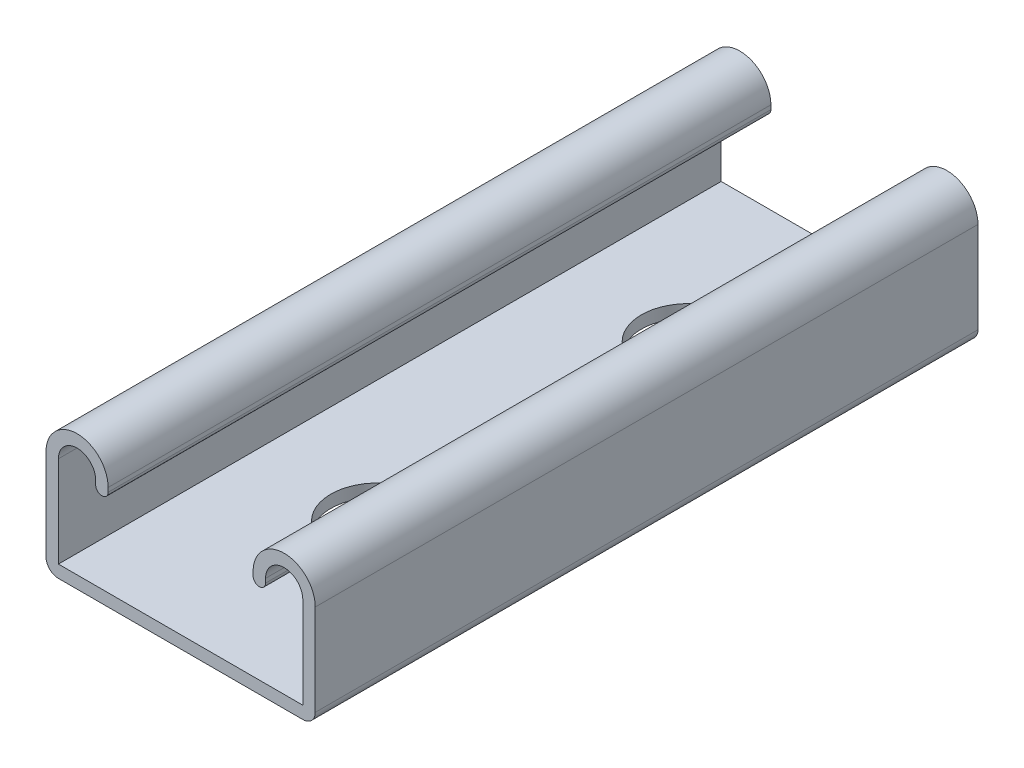
from build123d import *

# Parameters (mm, degrees)
BASE_EXTRUDE_DEPTH = 101.6
HOLE1_START        = -8.4582
HOLE1_OUTLINE_R    = 7.14375
HOLE1_DEPTH        = 1.905
LPATTERN2_COUNT    = 2
LPATTERN2_PITCH    = 47.625


with BuildPart() as part:
    # Sketch1 → Base-Extrude (new body)
    with BuildSketch(Plane.XY):
        with BuildLine():
            Line((-20.6375, 7.4295), (-20.6375, -6.5532))
            ThreePointArc((-20.6375, -6.5532), (-20.079538418, -7.900238418), (-18.7325, -8.4582))
            Line((-18.7325, -8.4582), (18.7325, -8.4582))
            ThreePointArc((18.7325, -8.4582), (20.079538418, -7.900238418), (20.6375, -6.5532))
            Line((20.6375, -6.5532), (20.6375, 7.4295))
            ThreePointArc((20.6375, 7.4295), (15.875, 12.192), (11.1125, 7.4295))
            Line((11.1125, 7.4295), (11.1125, 6.7945))
            ThreePointArc((11.1125, 6.7945), (12.065, 5.842), (13.0175, 6.7945))
            Line((13.0175, 6.7945), (13.0175, 7.4295))
            ThreePointArc((13.0175, 7.4295), (15.875, 10.287), (18.7325, 7.4295))
            Line((18.7325, 7.4295), (18.7325, -6.5532))
            Line((18.7325, -6.5532), (-18.7325, -6.5532))
            Line((-18.7325, -6.5532), (-18.7325, 7.4295))
            ThreePointArc((-18.7325, 7.4295), (-15.875, 10.287), (-13.0175, 7.4295))
            Line((-13.0175, 7.4295), (-13.0175, 6.7945))
            ThreePointArc((-13.0175, 6.7945), (-12.065, 5.842), (-11.1125, 6.7945))
            Line((-11.1125, 6.7945), (-11.1125, 7.4295))
            ThreePointArc((-11.1125, 7.4295), (-15.875, 12.192), (-20.6375, 7.4295))
        make_face()
    extrude(amount=BASE_EXTRUDE_DEPTH)

    # Hole1: read off the stored shape, not the designer's step
    # Hole1 outline → Hole1 (cut)
    with BuildSketch(Plane(origin=(0, 0, 0), x_dir=(1, 0, 0), z_dir=(0, 1, 0)).offset(HOLE1_START)):
        with Locations((0, -23.8125)):
            Circle(HOLE1_OUTLINE_R)
    hole1 = extrude(amount=HOLE1_DEPTH, mode=Mode.SUBTRACT)

    # LPattern2: Hole1 ×2
    with Locations(*[(0, 0, i * LPATTERN2_PITCH) for i in range(1, LPATTERN2_COUNT)]):
        add(hole1, mode=Mode.SUBTRACT)


solid = part.part
